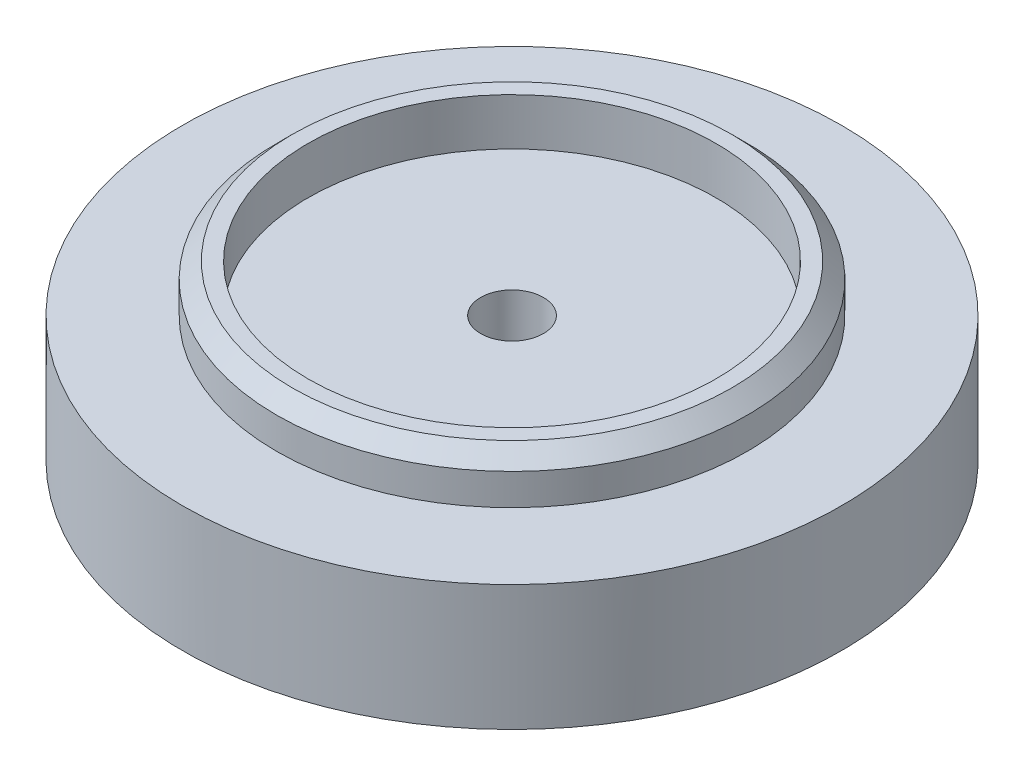
from build123d import *

# Parameters (mm, degrees)
SKETCH1_R           = 21
SKETCH1_R_2         = 2
BOSS_EXTRUDE1_DEPTH = 4
SKETCH2_R           = 15
SKETCH2_R_2         = 13
BOSS_EXTRUDE2_DEPTH = 3
CHAMFER1_SIZE       = 1
BOSS_EXTRUDE3_START = 4
SKETCH3_R           = 21
SKETCH3_R_2         = 2.5
BOSS_EXTRUDE3_DEPTH = 4
BOSS_EXTRUDE4_START = 2
SKETCH4_R           = 2.5
SKETCH4_R_2         = 2
BOSS_EXTRUDE4_DEPTH = 2


with BuildPart() as part:
    # Sketch1 → Boss-Extrude1 (new body)
    with BuildSketch(Plane(origin=(0, 0, 0), x_dir=(1, 0, 0), z_dir=(0, 1, 0))):
        Circle(SKETCH1_R)
        Circle(SKETCH1_R_2, mode=Mode.SUBTRACT)
    extrude(amount=BOSS_EXTRUDE1_DEPTH)

    # Sketch2 → Boss-Extrude2 (add)
    with BuildSketch(Plane(origin=(0, 4, 0), x_dir=(1, 0, 0), z_dir=(0, 1, 0))):
        Circle(SKETCH2_R)
        Circle(SKETCH2_R_2, mode=Mode.SUBTRACT)
    extrude(amount=BOSS_EXTRUDE2_DEPTH)

    # Chamfer1
    chamfer1_edges = [part.edges().sort_by_distance(p)[0] for p in [
        (-15, 7, 0),
    ]]
    chamfer(chamfer1_edges, length=CHAMFER1_SIZE)

    # Sketch3 → Boss-Extrude3 (add)
    with BuildSketch(Plane.XZ.offset(BOSS_EXTRUDE3_START)):
        Circle(SKETCH3_R)
        Circle(SKETCH3_R_2, mode=Mode.SUBTRACT)
    extrude(amount=-BOSS_EXTRUDE3_DEPTH)

    # Sketch4 → Boss-Extrude4 (add)
    with BuildSketch(Plane.XZ.offset(BOSS_EXTRUDE4_START)):
        Circle(SKETCH4_R)
        Circle(SKETCH4_R_2, mode=Mode.SUBTRACT)
    extrude(amount=-BOSS_EXTRUDE4_DEPTH)


solid = part.part
